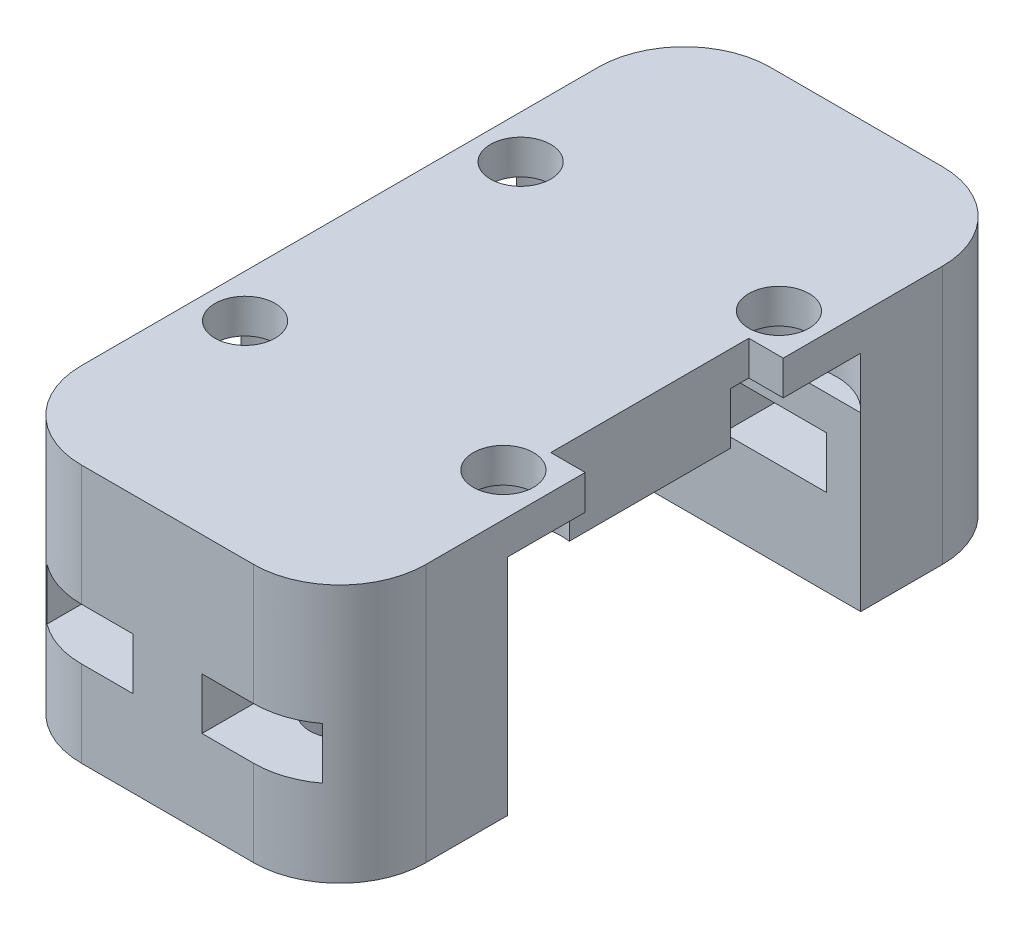
from build123d import *

# Parameters (mm, degrees)
SKETCH1_W           = 20
SKETCH1_H           = 40
BOSS_EXTRUDE1_DEPTH = 5
SKETCH2_W           = 20
SKETCH2_H           = 9.75
BOSS_EXTRUDE2_DEPTH = 10
SKETCH3_R           = 1.75
CUT_EXTRUDE1_DEPTH  = 5
SKETCH4_R           = 3.363406012
CUT_EXTRUDE2_DEPTH  = 3
SKETCH5_R           = 1.75
CUT_EXTRUDE3_DEPTH  = 8
SKETCH6_W           = 6
SKETCH6_H           = 10
CUT_EXTRUDE4_DEPTH  = 3
SKETCH7_R           = 1.75
CUT_EXTRUDE5_DEPTH  = 3
FILLET1_R           = 5
SKETCH10_W          = 11.5
SKETCH10_H          = 5
CUT_EXTRUDE6_DEPTH  = 2


with BuildPart() as part:
    # Sketch1 → Boss-Extrude1 (new body)
    with BuildSketch(Plane(origin=(0, 0, 0), x_dir=(1, 0, 0), z_dir=(0, 1, 0))):
        Rectangle(SKETCH1_W, SKETCH1_H)
    extrude(amount=BOSS_EXTRUDE1_DEPTH)

    # Sketch2 → Boss-Extrude2 (add)
    with BuildSketch(Plane.XZ):
        with Locations((0, 15.125)):
            Rectangle(SKETCH2_W, SKETCH2_H)
        with Locations((0, -15.125)):
            Rectangle(SKETCH2_W, SKETCH2_H)
    extrude(amount=BOSS_EXTRUDE2_DEPTH)

    # Sketch3 → Cut-Extrude1 (cut)
    with BuildSketch(Plane(origin=(0, 5, 0), x_dir=(1, 0, 0), z_dir=(0, 1, 0))):
        with Locations(Location((-7.5, -8, 0), (0, 0, 270))):
            Circle(SKETCH3_R)
        with Locations(Location((-7.5, 8, 0), (0, 0, 270))):
            Circle(SKETCH3_R)
        with Locations(Location((7.5, -8, 0), (0, 0, 270))):
            Circle(SKETCH3_R)
        with Locations(Location((7.5, 8, 0), (0, 0, 270))):
            Circle(SKETCH3_R)
    extrude(amount=-CUT_EXTRUDE1_DEPTH, mode=Mode.SUBTRACT)

    # Sketch4 → Cut-Extrude2 (cut)
    with BuildSketch(Plane.XZ):
        with Locations((7.5, 8)):
            Circle(SKETCH4_R)
        with Locations((-7.5, 8)):
            Circle(SKETCH4_R)
        with Locations((-7.5, -8)):
            Circle(SKETCH4_R)
        with Locations((7.5, -8)):
            Circle(SKETCH4_R)
    extrude(amount=-CUT_EXTRUDE2_DEPTH, mode=Mode.SUBTRACT)

    # Sketch5 → Cut-Extrude3 (cut)
    with BuildSketch(Plane.XZ.offset(10)):
        with Locations(Location((-5, -15, 0), (0, 0, 270))):
            Circle(SKETCH5_R)
        with Locations(Location((5, -15, 0), (0, 0, 270))):
            Circle(SKETCH5_R)
        with Locations(Location((-5, 15, 0), (0, 0, 270))):
            Circle(SKETCH5_R)
        with Locations(Location((5, 15, 0), (0, 0, 270))):
            Circle(SKETCH5_R)
    extrude(amount=-CUT_EXTRUDE3_DEPTH, mode=Mode.SUBTRACT)

    # Sketch6 → Cut-Extrude4 (cut)
    with BuildSketch(Plane.XZ.offset(2)):
        with Locations((-5, -15)):
            Rectangle(SKETCH6_W, SKETCH6_H)
        with Locations((5, -15)):
            Rectangle(SKETCH6_W, SKETCH6_H)
        with Locations((5, 15)):
            Rectangle(SKETCH6_W, SKETCH6_H)
        with Locations((-5, 15)):
            Rectangle(SKETCH6_W, SKETCH6_H)
    extrude(amount=CUT_EXTRUDE4_DEPTH, mode=Mode.SUBTRACT)

    # Sketch7 → Cut-Extrude5 (cut)
    with BuildSketch(Plane.XZ.offset(2)):
        with Locations(Location((-5, -15, 0), (0, 0, 270))):
            Circle(SKETCH7_R)
        with Locations(Location((5, -15, 0), (0, 0, 270))):
            Circle(SKETCH7_R)
        with Locations(Location((5, 15, 0), (0, 0, 270))):
            Circle(SKETCH7_R)
        with Locations(Location((-5, 15, 0), (0, 0, 270))):
            Circle(SKETCH7_R)
    extrude(amount=-CUT_EXTRUDE5_DEPTH, mode=Mode.SUBTRACT)

    # Fillet1
    # the kernel refuses this fillet: 5 mm, written as the material it takes off along each edge
    with BuildSketch(Plane(origin=(-10, 17.5, -20), x_dir=(0, 0, 1), z_dir=(0, -1, 0)), Plane(origin=(10, -22.5, -20), x_dir=(0, 0, 1), z_dir=(0, 1, 0)), Plane(origin=(-10, 17.5, 20), x_dir=(1, 0, 0), z_dir=(0, -1, 0)), Plane(origin=(10, -22.5, 20), x_dir=(-1, 0, 0), z_dir=(0, 1, 0))) as fillet1_piece_1:
        with BuildLine():
            CenterArc((FILLET1_R, -FILLET1_R), FILLET1_R, 90, 90)
            Line((0, -FILLET1_R), (0, 0))
            Line((0, 0), (FILLET1_R, 0))
        make_face()
    extrude(amount=40, mode=Mode.SUBTRACT)

    # Sketch10 → Cut-Extrude6 (cut)
    with BuildSketch(Plane(origin=(10, 0, 0), x_dir=(0, 0, -1), z_dir=(1, 0, 0))):
        with Locations((0, 2.5)):
            Rectangle(SKETCH10_W, SKETCH10_H)
    extrude(amount=-CUT_EXTRUDE6_DEPTH, mode=Mode.SUBTRACT)


solid = part.part
